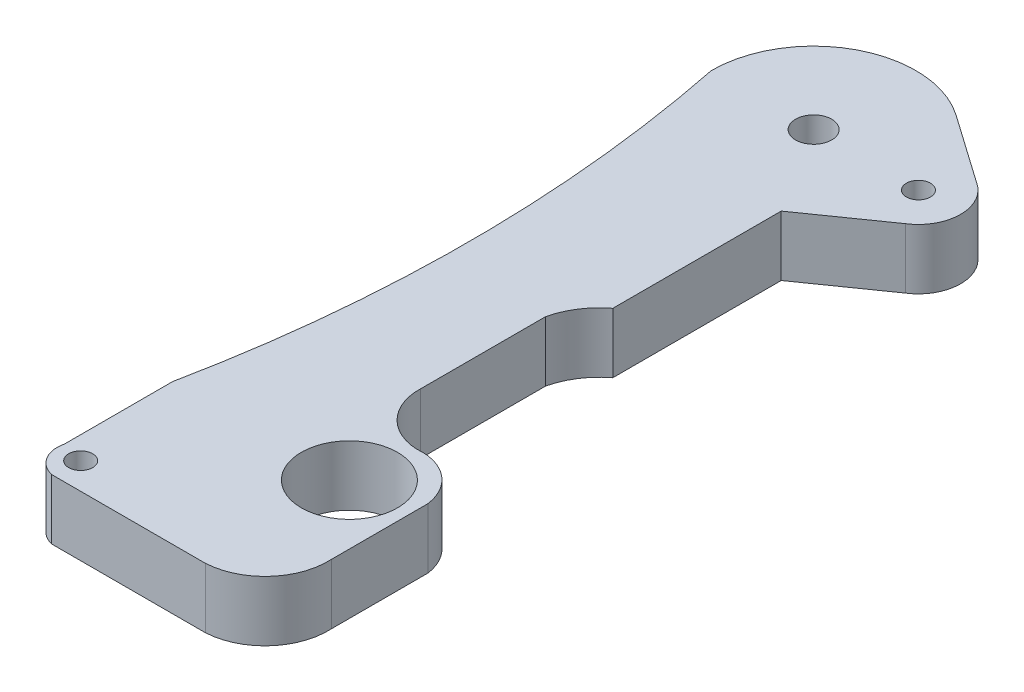
from build123d import *

# Parameters (mm, degrees)
SKETCH1_R           = 1
SKETCH1_R_2         = 4
SKETCH1_R_3         = 1.5
BOSS_EXTRUDE1_DEPTH = 5


with BuildPart() as part:
    # Sketch1 → Boss-Extrude1 (new body)
    with BuildSketch(Plane(origin=(0, 0, 0), x_dir=(1, 0, 0), z_dir=(0, 1, 0))):
        with BuildLine():
            Line((40.7852702, 74.193004021), (35.075266798, 78.198229556))
            ThreePointArc((35.075266798, 78.198229556), (26.272366536, 78.780683171), (21.694113287, 71.23946958))
            ThreePointArc((21.694113287, 71.23946958), (23.941923331, 48.851382594), (21.694113287, 26.463295609))
            Line((21.694113287, 26.463295609), (21.694113287, 17.463295609))
            ThreePointArc((21.694113287, 17.463295609), (21.954167675, 15.759997208), (23.342467746, 14.73946958))
            Line((23.342467746, 14.73946958), (33.841256749, 14.73946958))
            Line((33.841256749, 14.73946958), (36.132184269, 14.73946958))
            ThreePointArc((36.132184269, 14.73946958), (39.75713684, 16.478313044), (41.09081738, 20.271089593))
            Line((41.09081738, 20.271089593), (41.09081738, 28.286294101))
            ThreePointArc((41.09081738, 28.286294101), (39.602380799, 30.901377208), (36.712338736, 31.739088372))
            ThreePointArc((36.712338736, 31.739088372), (33.680921675, 33.128286782), (32.51969773, 36.254133959))
            Line((32.51969773, 36.254133959), (32.51969773, 46.640032758))
            ThreePointArc((32.51969773, 46.640032758), (33.320707465, 48.524930167), (34.713196388, 50.026738889))
            Line((34.713196388, 50.026738889), (34.713196388, 64.026738889))
            Line((34.713196388, 64.026738889), (40.7852702, 68.285935139))
            ThreePointArc((40.7852702, 68.285935139), (42.40733668, 71.23946958), (40.7852702, 74.193004021))
        make_face()
        with Locations((23.566412567, 16.94349474)):
            Circle(SKETCH1_R, mode=Mode.SUBTRACT)
        with Locations((36.132184269, 26.716174154)):
            Circle(SKETCH1_R_2, mode=Mode.SUBTRACT)
        with Locations((30.194113287, 71.23946958)):
            Circle(SKETCH1_R_3, mode=Mode.SUBTRACT)
        with BuildLine():
            ThreePointArc((38.639338163, 72.202888905), (39.512316631, 72.035710284), (39.90733668, 71.23946958))
            ThreePointArc((39.90733668, 71.23946958), (39.512316631, 70.443228877), (38.639338163, 70.276050256))
            ThreePointArc((38.639338163, 70.276050256), (37.90733668, 71.23946958), (38.639338163, 72.202888905))
        make_face(mode=Mode.SUBTRACT)
    extrude(amount=BOSS_EXTRUDE1_DEPTH)


solid = part.part
